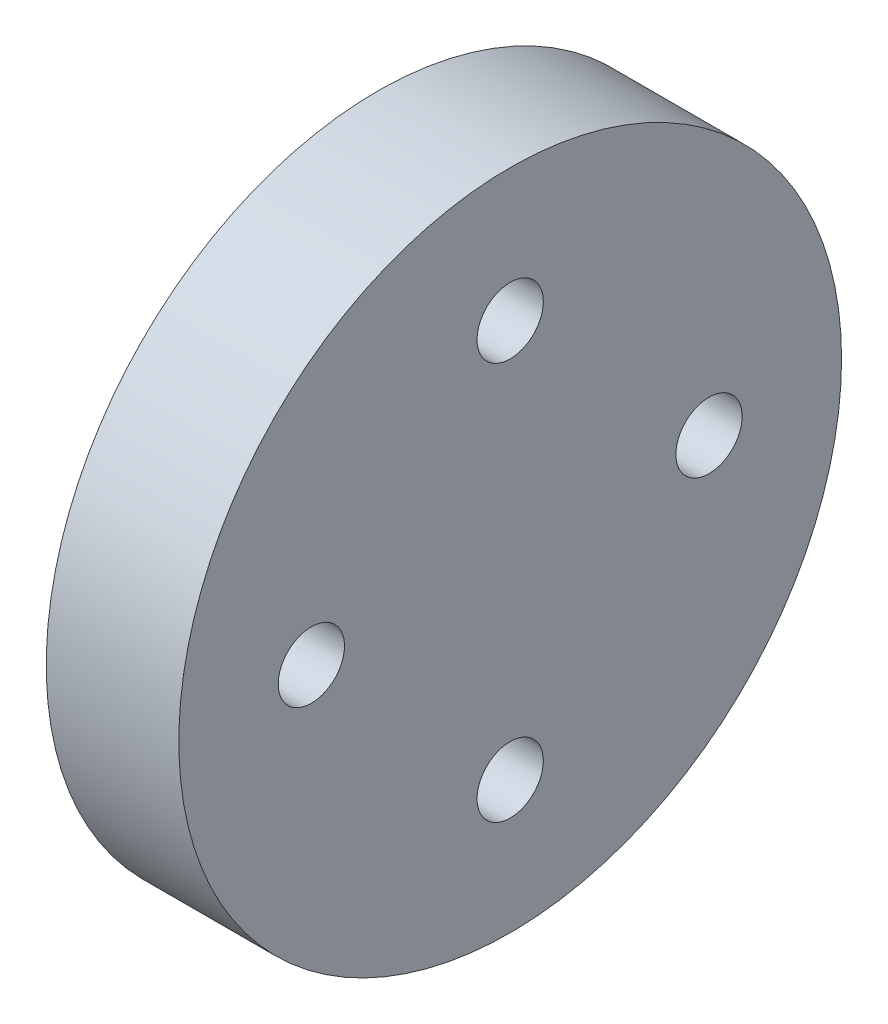
from build123d import *

# Parameters (mm, degrees)
SKETCH1_R           = 25
BOSS_EXTRUDE1_DEPTH = 10
SKETCH2_R           = 2.5
CUT_EXTRUDE1_DEPTH  = 10


with BuildPart() as part:
    # Sketch1 → Boss-Extrude1 (new body)
    with BuildSketch(Plane(origin=(0, 0, 0), x_dir=(0, 0, -1), z_dir=(1, 0, 0))):
        Circle(SKETCH1_R)
    extrude(amount=BOSS_EXTRUDE1_DEPTH)

    # Sketch2 → Cut-Extrude1 (cut)
    with BuildSketch(Plane(origin=(0, 0, 0), x_dir=(0, 0, -1), z_dir=(1, 0, 0))):
        with Locations((-15, 0)):
            Circle(SKETCH2_R)
        with Locations((15, 0)):
            Circle(SKETCH2_R)
        with Locations((0, 15)):
            Circle(SKETCH2_R)
        with Locations((0, -15)):
            Circle(SKETCH2_R)
    extrude(amount=CUT_EXTRUDE1_DEPTH, mode=Mode.SUBTRACT)


solid = part.part
